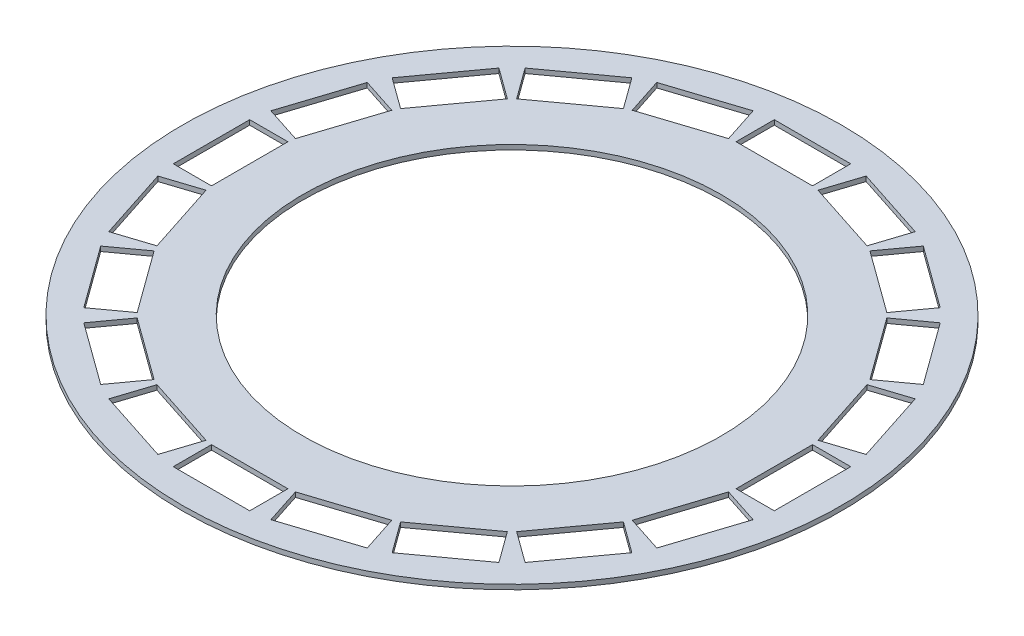
from build123d import *

# Parameters (mm, degrees)
SKETCH1_W          = 40
SKETCH1_H          = 1.5875
SKETCH2_W          = 25.4
SKETCH2_H          = 12.7
CUT_EXTRUDE1_DEPTH = 155.864521942
CIRPATTERN1_COUNT  = 20


with BuildPart() as part:
    # Sketch1 → Revolve1 (revolve)
    with BuildSketch(Plane.XY):
        with Locations((-89.5, 6.57875)):
            Rectangle(SKETCH1_W, SKETCH1_H)
    revolve(axis=Axis((0, -200069.047495165, 0), (0, 1, 0)))

    # Sketch2 → Cut-Extrude1 (cut, through all)
    with BuildSketch(Plane(origin=(0, 7.3725, 0), x_dir=(1, 0, 0), z_dir=(0, 1, 0))):
        with Locations((0, 93.5)):
            Rectangle(SKETCH2_W, SKETCH2_H)
    cut_extrude1 = extrude(amount=-CUT_EXTRUDE1_DEPTH, mode=Mode.SUBTRACT)

    # CirPattern1: Cut-Extrude1 ×20 about axis
    cirpattern1_axis = Axis((0, -200069.047495165, 0), (0, -1, 0))
    for i in range(1, CIRPATTERN1_COUNT):
        add(cut_extrude1.rotate(cirpattern1_axis, i * 360 / CIRPATTERN1_COUNT), mode=Mode.SUBTRACT)


solid = part.part
